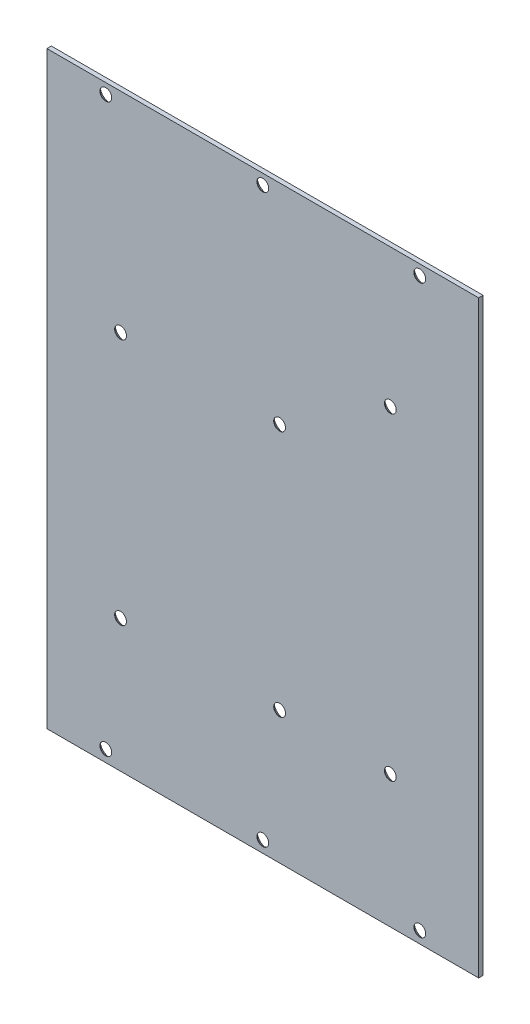
from build123d import *

# Parameters (mm, degrees)
SKETCH_1_W          = 146.6
SKETCH_1_H          = 200
EXTRUDE_1_DEPTH     = 1.5
SKETCH_2_R          = 2
CUT_EXTRUDE_1_DEPTH = 248.979454794
SKETCH_3_R          = 2
CUT_EXTRUDE_2_DEPTH = 248.979454794
SKETCH_4_R          = 2
CUT_EXTRUDE_3_DEPTH = 248.979454794
CHAMFER_1_SIZE      = 1.4


with BuildPart() as part:
    # Эскиз1 → Бобышка-Вытянуть1 (new body)
    with BuildSketch(Plane.XY):
        with Locations((73.3, 100)):
            Rectangle(SKETCH_1_W, SKETCH_1_H)
    extrude(amount=EXTRUDE_1_DEPTH)

    # Эскиз2 → Вырез-Вытянуть1 (cut, through all)
    with BuildSketch(Plane.XY.offset(1.5)):
        with Locations((20, 4)):
            Circle(SKETCH_2_R)
        with Locations((20, 196.5)):
            Circle(SKETCH_2_R)
        with Locations((73.3, 196.5)):
            Circle(SKETCH_2_R)
        with Locations((73.3, 4)):
            Circle(SKETCH_2_R)
        with Locations((126.6, 196.5)):
            Circle(SKETCH_2_R)
        with Locations((126.6, 4)):
            Circle(SKETCH_2_R)
    extrude(amount=-CUT_EXTRUDE_1_DEPTH, mode=Mode.SUBTRACT)

    # Эскиз3 → Вырез-Вытянуть2 (cut, through all)
    with BuildSketch(Plane.XY.offset(1.5)):
        with Locations((25, 45)):
            Circle(SKETCH_3_R)
        with Locations((79, 45)):
            Circle(SKETCH_3_R)
        with Locations((79, 129)):
            Circle(SKETCH_3_R)
        with Locations((25, 129)):
            Circle(SKETCH_3_R)
    extrude(amount=-CUT_EXTRUDE_2_DEPTH, mode=Mode.SUBTRACT)

    # Эскиз4 → Вырез-Вытянуть3 (cut, through all)
    with BuildSketch(Plane.XY.offset(1.5)):
        with Locations((116.6, 45)):
            Circle(SKETCH_4_R)
        with Locations((116.6, 153)):
            Circle(SKETCH_4_R)
    extrude(amount=-CUT_EXTRUDE_3_DEPTH, mode=Mode.SUBTRACT)

    # Фаска1
    chamfer_1_edges = [part.edges().sort_by_distance(p)[0] for p in [
        (124.6, 4, 0),
        (114.6, 45, 0),
        (77, 45, 0),
        (71.3, 4, 0),
        (18, 4, 0),
        (23, 45, 0),
        (23, 129, 0),
        (18, 196.5, 0),
        (71.3, 196.5, 0),
        (77, 129, 0),
        (114.6, 153, 0),
        (124.6, 196.5, 0),
    ]]
    chamfer(chamfer_1_edges, length=CHAMFER_1_SIZE)


solid = part.part
